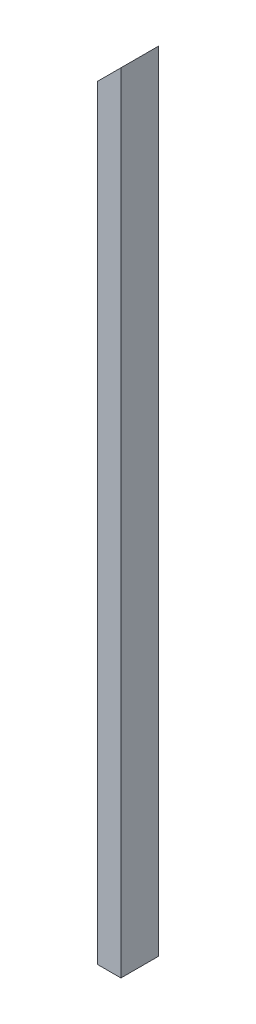
from build123d import *

# Parameters (mm, degrees)
BOSS_EXTRUDE1_DEPTH = 101.6


with BuildPart() as part:
    # Sketch3 → Boss-Extrude1 (new body)
    with BuildSketch(Plane.XY):
        Polygon((0, 0), (0, 2057.4), (63.5, 2120.9), (63.5, 0), align=None)
    extrude(amount=BOSS_EXTRUDE1_DEPTH)


solid = part.part
